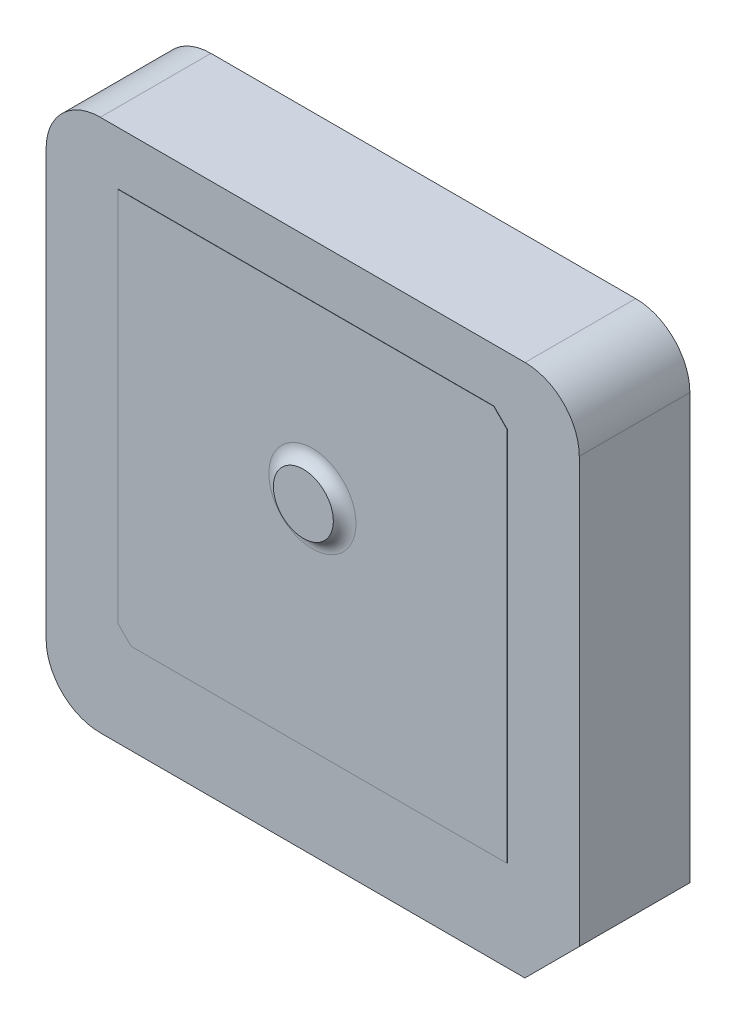
from build123d import *

# Parameters (mm, degrees)
SKETCH1_W           = 20
SKETCH1_H           = 20
BOSS_EXTRUDE1_DEPTH = 4.15
SKETCH4_R           = 1.125
BOSS_EXTRUDE3_DEPTH = 0.35
SKETCH5_W           = 14.6
SKETCH5_H           = 14.6
BOSS_EXTRUDE4_DEPTH = 0.01
FILLET1_R           = 0.55
CHAMFER1_SIZE       = 0.5
CUT_EXTRUDE1_DEPTH  = 15.73847007
SKETCH7_R           = 0.4
BOSS_EXTRUDE5_DEPTH = 2


with BuildPart() as part:
    # Sketch1 → Boss-Extrude1 (new body)
    with BuildSketch(Plane.XY):
        Rectangle(SKETCH1_W, SKETCH1_H)
    extrude(amount=BOSS_EXTRUDE1_DEPTH)

    # Sketch4 → Boss-Extrude3 (add)
    with BuildSketch(Plane.XY.offset(4.15)):
        with Locations((0, 1.6)):
            Circle(SKETCH4_R)
    extrude(amount=BOSS_EXTRUDE3_DEPTH)

    # Sketch5 → Boss-Extrude4 (add)
    with BuildSketch(Plane.XY.offset(4.15)):
        with Locations((0, 0.7)):
            Rectangle(SKETCH5_W, SKETCH5_H)
    extrude(amount=BOSS_EXTRUDE4_DEPTH)

    # Fillet1
    # the kernel refuses this fillet: 0.55 mm, written as the material it adds along each edge
    with BuildSketch(Plane(origin=(0, 1.6, 4.16), x_dir=(1, 0, 0), z_dir=(0, 1, 0))) as fillet1_piece_1:
        with BuildLine():
            CenterArc((1.633330601, -0.55), FILLET1_R, 90, 67.553649419)
            Line((1.125, -0.34), (1.114833388, -0.3358))
            ThreePointArc((1.114833388, -0.3358), (1.114, -0.17), (1.114, 0))
            Line((1.114, 0), (1.125, 0.011))
            Line((1.125, 0.011), (1.633330601, 0.011))
            Line((1.633330601, 0.011), (1.633330601, 0))
        make_face()
    revolve(axis=Axis((0, 1.6, 4.16), (0, 0, -1)))

    # Chamfer1
    chamfer1_edges = [part.edges().sort_by_distance(p)[0] for p in [
        (-7.3, -6.6, 4.155),
        (7.3, 8, 4.155),
    ]]
    chamfer(chamfer1_edges, length=CHAMFER1_SIZE)

    # Sketch6 → Cut-Extrude1 (cut, through all)
    with BuildSketch(Plane.XY.offset(4.15)):
        Polygon((7.960512242, -10), (10, -7.960512242), (10, -10), align=None)
        with BuildLine():
            Line((10, 7.966904756), (10, 10))
            Line((10, 10), (7.966904756, 10))
            ThreePointArc((7.966904756, 10), (9.40452019, 9.40452019), (10, 7.966904756))
        make_face()
        with BuildLine():
            Line((-7.966904756, 10), (-10, 10))
            Line((-10, 10), (-10, 7.966904756))
            ThreePointArc((-10, 7.966904756), (-9.40452019, 9.40452019), (-7.966904756, 10))
        make_face()
        with BuildLine():
            Line((-10, -7.966904756), (-10, -10))
            Line((-10, -10), (-7.966904756, -10))
            ThreePointArc((-7.966904756, -10), (-9.40452019, -9.40452019), (-10, -7.966904756))
        make_face()
    extrude(amount=-CUT_EXTRUDE1_DEPTH, mode=Mode.SUBTRACT)

    # Sketch7 → Boss-Extrude5 (add)
    with BuildSketch(Plane(origin=(0, 0, 0), x_dir=(-1, 0, 0), z_dir=(0, 0, -1))):
        with Locations(Location((0, 1.6, 0), (0, 0, 180))):
            Circle(SKETCH7_R)
    extrude(amount=BOSS_EXTRUDE5_DEPTH)


solid = part.part
